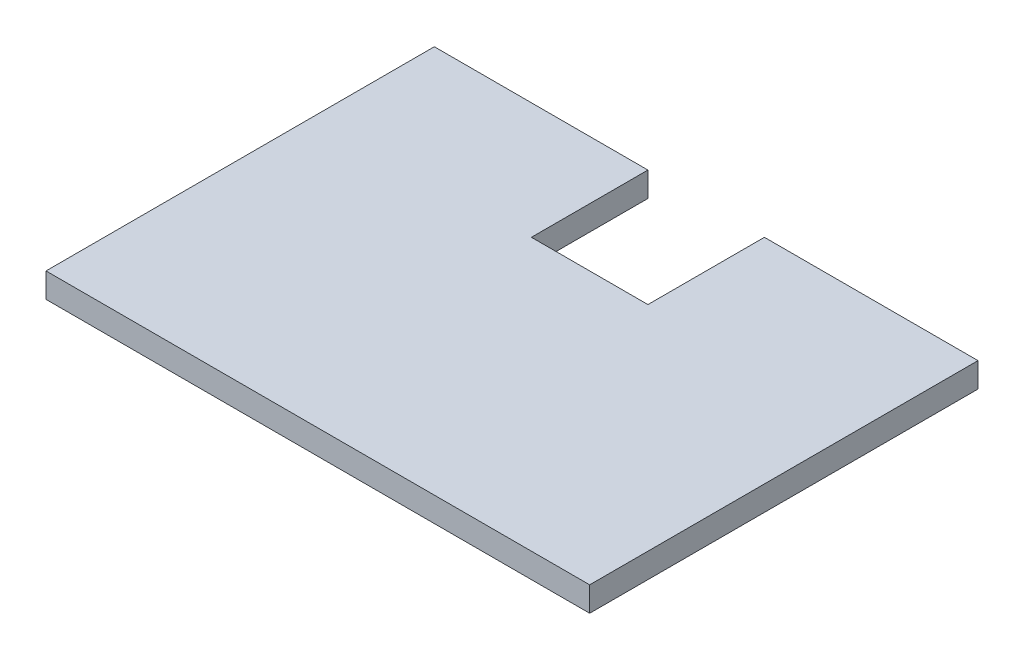
from build123d import *

# Parameters (mm, degrees)
SKETCH1_W           = 70
SKETCH1_H           = 50
BOSS_EXTRUDE1_DEPTH = 3.175
SKETCH2_W           = 15
SKETCH2_H           = 15
CUT_EXTRUDE1_DEPTH  = 44.128652019


with BuildPart() as part:
    # Sketch1 → Boss-Extrude1 (new body)
    with BuildSketch(Plane(origin=(0, 0, 0), x_dir=(1, 0, 0), z_dir=(0, 1, 0))):
        Rectangle(SKETCH1_W, SKETCH1_H)
    extrude(amount=BOSS_EXTRUDE1_DEPTH)

    # Sketch2 → Cut-Extrude1 (cut, through all)
    with BuildSketch(Plane(origin=(0, 3.175, 0), x_dir=(1, 0, 0), z_dir=(0, 1, 0))):
        with Locations((0, 17.5)):
            Rectangle(SKETCH2_W, SKETCH2_H)
    extrude(amount=-CUT_EXTRUDE1_DEPTH, mode=Mode.SUBTRACT)


solid = part.part
